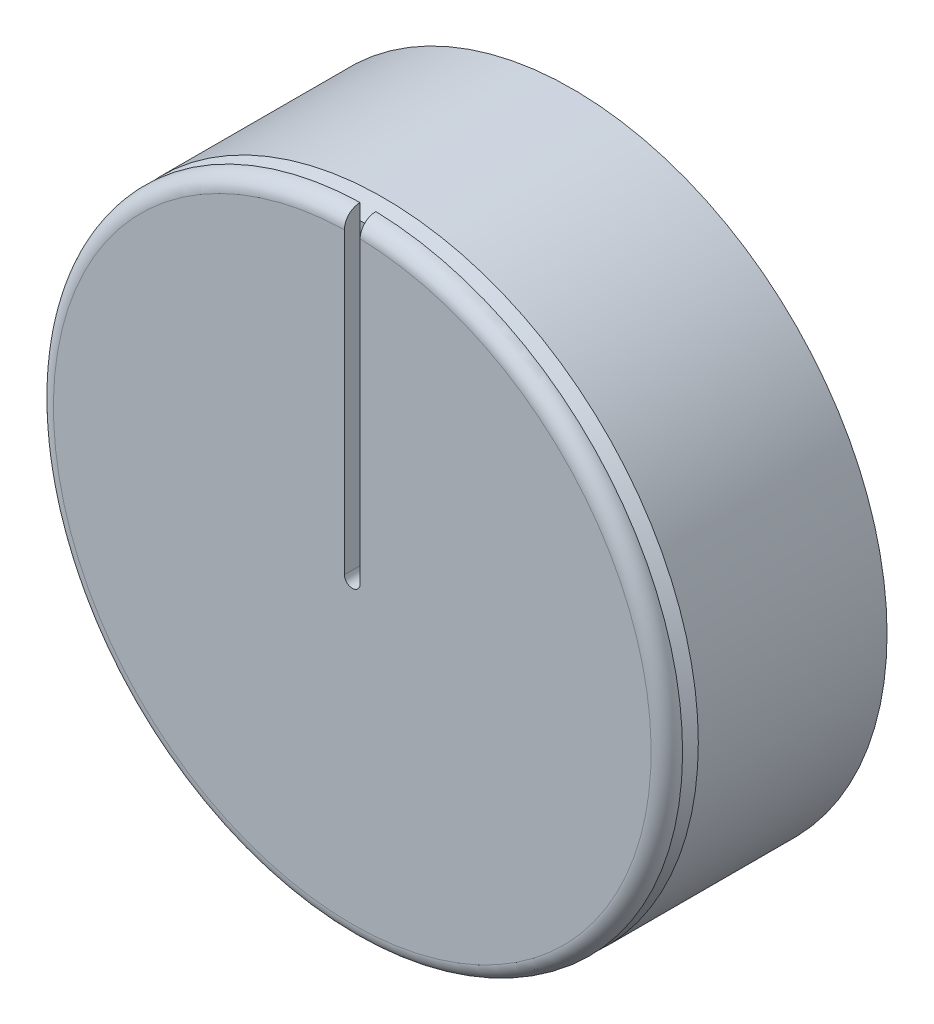
from build123d import *

# Parameters (mm, degrees)
BOSS_EXTRUDE1_START = 1
SKETCH1_R           = 20
BOSS_EXTRUDE1_DEPTH = 14
FILLET2_R           = 1
CUT_EXTRUDE1_DEPTH  = 1
CUT_EXTRUDE2_START  = -2
SKETCH4_R           = 20
SKETCH4_R_2         = 19
CUT_EXTRUDE2_DEPTH  = 1
CHAMFER1_SIZE       = 1
SKETCH5_R           = 3.025
CUT_EXTRUDE3_DEPTH  = 10.5
SKETCH6_R           = 10
CUT_EXTRUDE4_DEPTH  = 5


with BuildPart() as part:
    # Sketch1 → Boss-Extrude1 (new body)
    with BuildSketch(Plane.XY.offset(BOSS_EXTRUDE1_START)):
        with Locations((51.181970815, -61.974353767)):
            Circle(SKETCH1_R)
    extrude(amount=BOSS_EXTRUDE1_DEPTH)

    # Fillet2
    fillet2_edges = [part.edges().sort_by_distance(p)[0] for p in [
        (31.181970815, -61.974353767, 15),
    ]]
    fillet(fillet2_edges, radius=FILLET2_R)

    # Sketch3 → Cut-Extrude1 (cut)
    with BuildSketch(Plane.XY.offset(15)):
        with BuildLine():
            Line((50.681970815, -61.974353767), (50.681970815, -41.974353767))
            ThreePointArc((50.681970815, -41.974353767), (51.181970815, -41.474353767), (51.681970815, -41.974353767))
            Line((51.681970815, -41.974353767), (51.681970815, -61.974353767))
            ThreePointArc((51.681970815, -61.974353767), (51.181970815, -62.474353767), (50.681970815, -61.974353767))
        make_face()
    extrude(amount=-CUT_EXTRUDE1_DEPTH, mode=Mode.SUBTRACT)

    # Sketch4 → Cut-Extrude2 (cut)
    with BuildSketch(Plane.XY.offset(15).offset(CUT_EXTRUDE2_START)):
        with Locations((51.181970815, -61.974353767)):
            Circle(SKETCH4_R)
        with Locations((51.181970815, -61.974353767)):
            Circle(SKETCH4_R_2, mode=Mode.SUBTRACT)
    extrude(amount=CUT_EXTRUDE2_DEPTH, mode=Mode.SUBTRACT)

    # Chamfer1
    chamfer1_edges = [part.edges().sort_by_distance(p)[0] for p in [
        (32.181970815, -61.974353767, 13),
    ]]
    chamfer(chamfer1_edges, length=CHAMFER1_SIZE - 0.0001)  # a hair under: the kernel refuses the full size

    # Sketch5 → Cut-Extrude3 (cut)
    with BuildSketch(Plane(origin=(0, 0, 1), x_dir=(-1, 0, 0), z_dir=(0, 0, -1))):
        with Locations((-51.181970815, -61.974353767)):
            Circle(SKETCH5_R)
    extrude(amount=-CUT_EXTRUDE3_DEPTH, mode=Mode.SUBTRACT)

    # Sketch6 → Cut-Extrude4 (cut)
    with BuildSketch(Plane(origin=(0, 0, 1), x_dir=(-1, 0, 0), z_dir=(0, 0, -1))):
        with Locations((-51.181970815, -61.974353767)):
            Circle(SKETCH6_R)
    extrude(amount=-CUT_EXTRUDE4_DEPTH, mode=Mode.SUBTRACT)


solid = part.part
